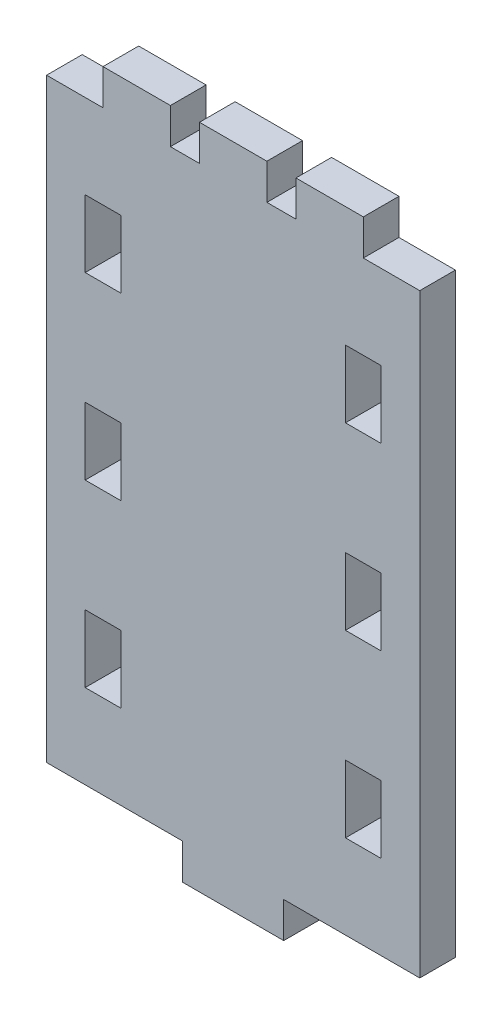
from build123d import *

# Parameters (mm, degrees)
SKETCH1_W           = 3.175
SKETCH1_H           = 6
BOSS_EXTRUDE1_DEPTH = 1.5875


with BuildPart() as part:
    # Sketch1 → Boss-Extrude1 (new, symmetric)
    with BuildSketch(Plane.XY):
        Polygon((0, 0), (-12.1125, 0), (-12.1125, -3.175), (-21.1125, -3.175), (-21.1125, 0), (-33.225, 0), (-33.225, 53), (-28.2, 53), (-28.2, 56.175), (-22.2, 56.175), (-22.2, 53), (-19.6125, 53), (-19.6125, 56.175), (-13.6125, 56.175), (-13.6125, 53), (-11.025, 53), (-11.025, 56.175), (-5.025, 56.175), (-5.025, 53), (0, 53), align=None)
        with Locations((-5.025, 10.5)):
            Rectangle(SKETCH1_W, SKETCH1_H, mode=Mode.SUBTRACT)
        Polygon((-5.025, 23.5), (-3.4375, 23.5), (-3.4375, 29.5), (-6.6125, 29.5), (-6.6125, 23.5), align=None, mode=Mode.SUBTRACT)
        Polygon((-5.025, 39.5), (-3.4375, 39.5), (-3.4375, 45.5), (-6.6125, 45.5), (-6.6125, 39.5), align=None, mode=Mode.SUBTRACT)
        Polygon((-26.6125, 39.5), (-28.2, 39.5), (-29.7875, 39.5), (-29.7875, 45.5), (-26.6125, 45.5), align=None, mode=Mode.SUBTRACT)
        Polygon((-26.6125, 23.5), (-28.2, 23.5), (-29.7875, 23.5), (-29.7875, 29.5), (-26.6125, 29.5), align=None, mode=Mode.SUBTRACT)
        with Locations((-28.2, 10.5)):
            Rectangle(SKETCH1_W, SKETCH1_H, mode=Mode.SUBTRACT)
    extrude(amount=BOSS_EXTRUDE1_DEPTH, both=True)


solid = part.part
